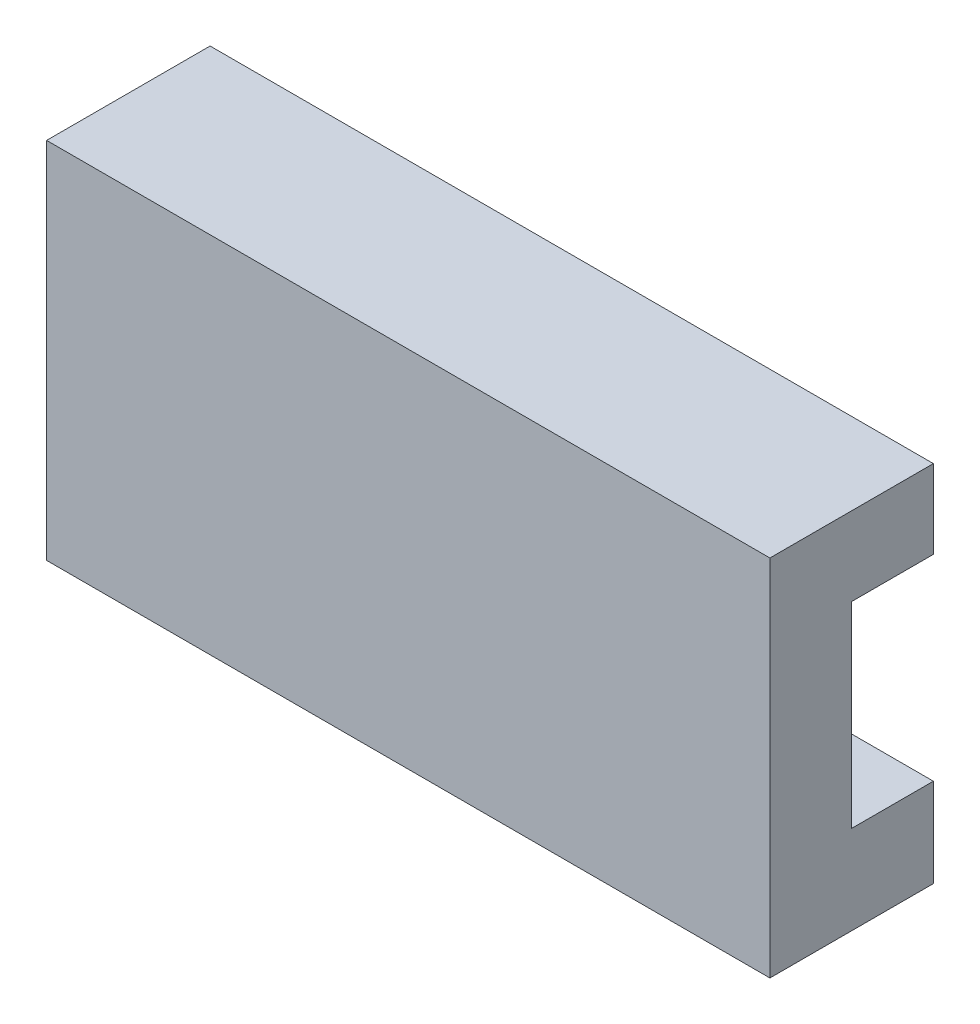
from build123d import *

# Parameters (mm, degrees)
SKETCH1_W           = 44.241636344
SKETCH1_H           = 22.25
BOSS_EXTRUDE1_DEPTH = 10
SKETCH2_W           = 44.241636344
SKETCH2_H           = 12.016013524
CUT_EXTRUDE1_DEPTH  = 5


with BuildPart() as part:
    # Sketch1 → Boss-Extrude1 (new body)
    with BuildSketch(Plane.XY):
        with Locations((0, 1.625)):
            Rectangle(SKETCH1_W, SKETCH1_H)
    extrude(amount=BOSS_EXTRUDE1_DEPTH)

    # Sketch2 → Cut-Extrude1 (cut)
    with BuildSketch(Plane.XY):
        with Locations((0, 1.933466246)):
            Rectangle(SKETCH2_W, SKETCH2_H)
    extrude(amount=CUT_EXTRUDE1_DEPTH, mode=Mode.SUBTRACT)


solid = part.part
